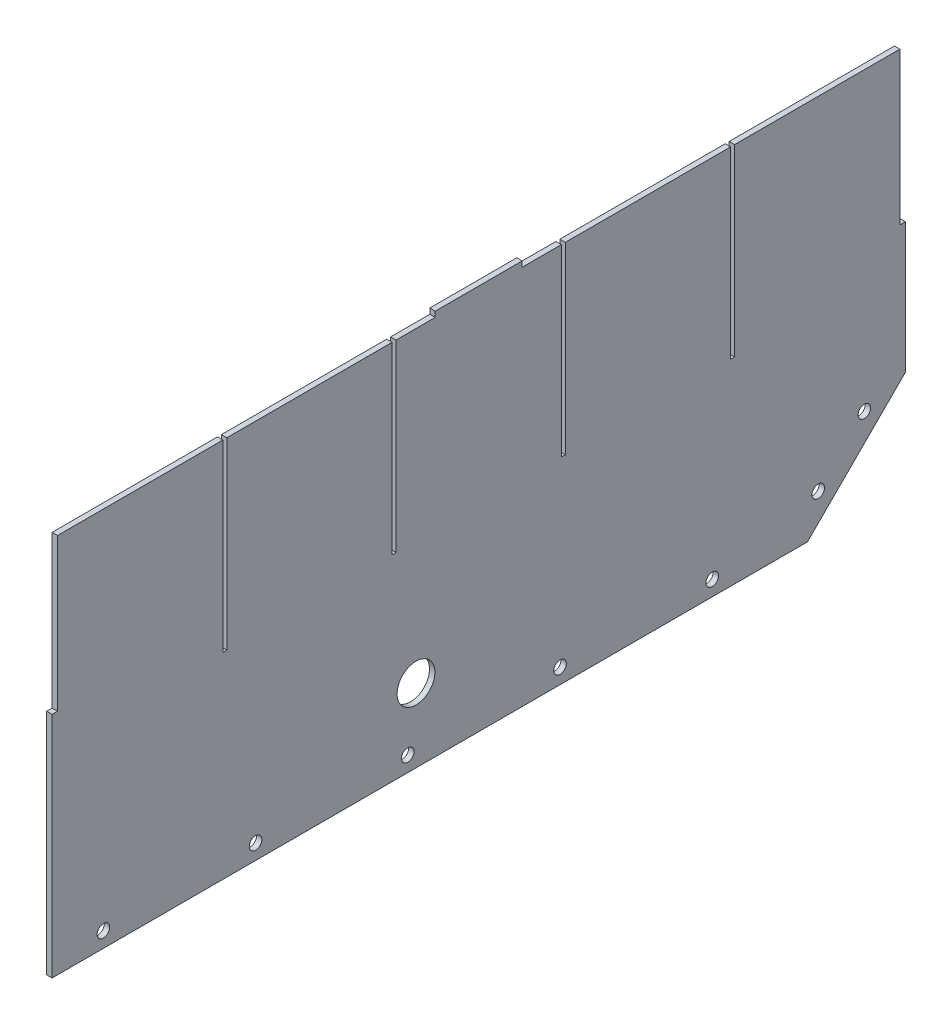
from build123d import *

# Parameters (mm, degrees)
SKETCH1_W           = 498.348
SKETCH1_H           = 165.1
BOSS_EXTRUDE1_DEPTH = 1.5875
BOSS_EXTRUDE2_DEPTH = 3.175
SKETCH3_R           = 3.675
CUT_EXTRUDE1_DEPTH  = 286.681383539
LPATTERN1_COUNT     = 5
LPATTERN1_PITCH     = 88.9
SKETCH4_R           = 3.675
CUT_EXTRUDE2_DEPTH  = 286.681383539
LPATTERN2_COUNT     = 2
LPATTERN2_PITCH     = 38.1
SKETCH5_W           = 3.175
SKETCH5_H           = 88.9
CUT_EXTRUDE3_DEPTH  = 286.681383539
SKETCH6_W           = 2.286
SKETCH6_H           = 107.442
CUT_EXTRUDE4_DEPTH  = 286.681383539
LPATTERN3_COUNT     = 4
LPATTERN3_PITCH     = 98.8568
SKETCH8_W           = 50.8
SKETCH8_H           = 3.175
BOSS_EXTRUDE3_DEPTH = 3.175
SKETCH9_R           = 11.05
CUT_EXTRUDE5_DEPTH  = 286.681383539


with BuildPart() as part:
    # Sketch1 → Boss-Extrude1 (new, symmetric)
    with BuildSketch(Plane(origin=(0, 0, 0), x_dir=(0, 0, -1), z_dir=(1, 0, 0))):
        Rectangle(SKETCH1_W, SKETCH1_H)
    extrude(amount=BOSS_EXTRUDE1_DEPTH, both=True)

    # Sketch2 → Boss-Extrude2 (add)
    with BuildSketch(Plane(origin=(1.5875, 0, 0), x_dir=(0, 0, -1), z_dir=(1, 0, 0))):
        Polygon((192.024, -139.7), (249.174, -82.55), (-249.174, -82.55), (-249.174, -139.7), align=None)
    extrude(amount=-BOSS_EXTRUDE2_DEPTH)

    # Sketch3 → Cut-Extrude1 (cut, through all)
    with BuildSketch(Plane.ZY.offset(1.5875)):
        with Locations((219.202, -130.81)):
            Circle(SKETCH3_R)
    cut_extrude1 = extrude(amount=-CUT_EXTRUDE1_DEPTH, mode=Mode.SUBTRACT)

    # LPattern1: Cut-Extrude1 ×5
    with Locations(*[(0, 0, -i * LPATTERN1_PITCH) for i in range(1, LPATTERN1_COUNT)]):
        add(cut_extrude1, mode=Mode.SUBTRACT)

    # Sketch4 → Cut-Extrude2 (cut, symmetric)
    with BuildSketch(Plane.ZY.offset(1.5875)):
        with Locations((-198.310179285, -117.249359697)):
            Circle(SKETCH4_R)
    cut_extrude2 = extrude(amount=CUT_EXTRUDE2_DEPTH, both=True, mode=Mode.SUBTRACT)

    # LPattern2: Cut-Extrude2 ×2
    with Locations(*[Vector(0, 0.7071067811865439, -0.7071067811865512) * (i * LPATTERN2_PITCH) for i in range(1, LPATTERN2_COUNT)]):
        add(cut_extrude2, mode=Mode.SUBTRACT)

    # Sketch5 → Cut-Extrude3 (cut, through all)
    with BuildSketch(Plane(origin=(1.5875, 0, 0), x_dir=(0, 0, -1), z_dir=(1, 0, 0))):
        with Locations((247.5865, 38.1)):
            Rectangle(SKETCH5_W, SKETCH5_H)
        with Locations((-247.5865, 38.1)):
            Rectangle(SKETCH5_W, SKETCH5_H)
    extrude(amount=-CUT_EXTRUDE3_DEPTH, mode=Mode.SUBTRACT)

    # Sketch6 → Cut-Extrude4 (cut, through all)
    with BuildSketch(Plane(origin=(1.5875, 0, 0), x_dir=(0, 0, -1), z_dir=(1, 0, 0))):
        with Locations((148.2852, 28.829)):
            Rectangle(SKETCH6_W, SKETCH6_H)
    cut_extrude4 = extrude(amount=-CUT_EXTRUDE4_DEPTH, mode=Mode.SUBTRACT)

    # LPattern3: Cut-Extrude4 ×4
    with Locations(*[(0, 0, i * LPATTERN3_PITCH) for i in range(1, LPATTERN3_COUNT)]):
        add(cut_extrude4, mode=Mode.SUBTRACT)

    # Sketch8 → Boss-Extrude3 (add)
    with BuildSketch(Plane(origin=(1.5875, 0, 0), x_dir=(0, 0, -1), z_dir=(1, 0, 0))):
        with Locations((0, 84.1375)):
            Rectangle(SKETCH8_W, SKETCH8_H)
    extrude(amount=-BOSS_EXTRUDE3_DEPTH)

    # Sketch9 → Cut-Extrude5 (cut, through all)
    with BuildSketch(Plane(origin=(1.5875, 0, 0), x_dir=(0, 0, -1), z_dir=(1, 0, 0))):
        with Locations((-36.6268, -96.7994)):
            Circle(SKETCH9_R)
    extrude(amount=-CUT_EXTRUDE5_DEPTH, mode=Mode.SUBTRACT)


solid = part.part
